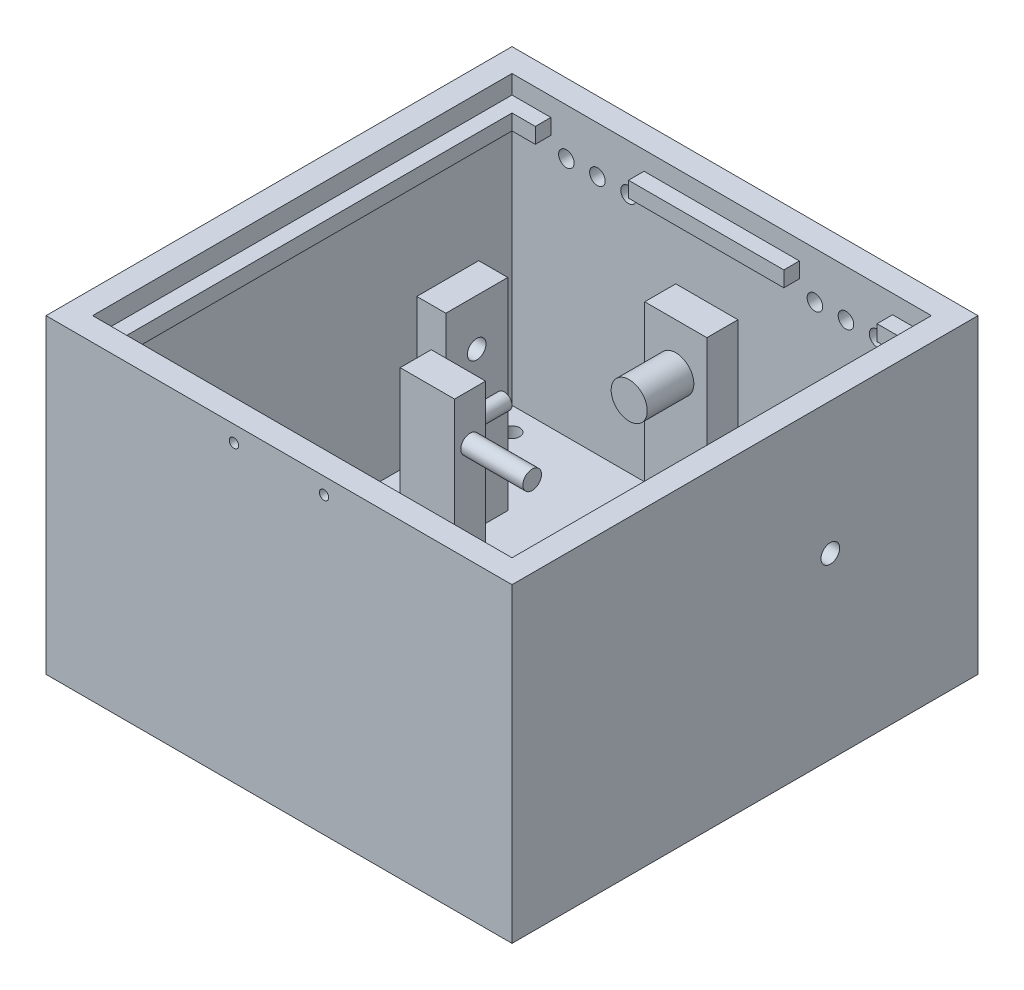
from build123d import *

# Parameters (mm, degrees)
SKETCH1_W            = 150
SKETCH1_H            = 150
BOSS_EXTRUDE1_DEPTH  = 7.5
SKETCH2_W            = 150
SKETCH2_H            = 150
SKETCH2_W_2          = 135
SKETCH2_H_2          = 135
BOSS_EXTRUDE2_DEPTH  = 92.5
SKETCH3_W            = 20
SKETCH3_H            = 10
BOSS_EXTRUDE3_DEPTH  = 65
SKETCH4_R            = 5.8075
BOSS_EXTRUDE4_DEPTH  = 15
SKETCH5_W            = 9.35632758
SKETCH5_H            = 19.933045712
BOSS_EXTRUDE5_DEPTH  = 65
SKETCH7_W            = 17.5
SKETCH7_H            = 5
BOSS_EXTRUDE7_DEPTH  = 65
SKETCH8_R            = 2.5
BOSS_EXTRUDE8_DEPTH  = 17.5
SKETCH10_W           = 17.5
SKETCH10_H           = 5
BOSS_EXTRUDE10_DEPTH = 65
SKETCH12_R           = 3
BOSS_EXTRUDE11_DEPTH = 20
SKETCH6_R            = 3
CUT_EXTRUDE1_DEPTH   = 10
SKETCH13_W           = 16
SKETCH13_H           = 12
BOSS_EXTRUDE12_DEPTH = 12.5
SKETCH14_W           = 35
SKETCH14_H           = 41
BOSS_EXTRUDE13_DEPTH = 31
SKETCH15_R           = 3
CUT_EXTRUDE2_DEPTH   = 10
SKETCH16_W           = 150
SKETCH16_H           = 5
BOSS_EXTRUDE14_DEPTH = 5
SKETCH17_W           = 12.5
SKETCH17_H           = 5
SKETCH17_W_2         = 50
BOSS_EXTRUDE15_DEPTH = 5
SKETCH18_W           = 150
SKETCH18_H           = 5
BOSS_EXTRUDE16_DEPTH = 5
SKETCH19_W           = 150
SKETCH19_H           = 5
BOSS_EXTRUDE17_DEPTH = 5
SKETCH20_R           = 2.5
CUT_EXTRUDE3_DEPTH   = 10
SKETCH21_R           = 2.5
CUT_EXTRUDE4_DEPTH   = 10
SKETCH22_R           = 1.5
CUT_EXTRUDE5_DEPTH   = 5
SKETCH23_R           = 1
SKETCH23_R_2         = 0.6
CUT_EXTRUDE6_DEPTH   = 4
SKETCH24_R           = 0.75
SKETCH24_R_2         = 0.5
CUT_EXTRUDE7_DEPTH   = 4


with BuildPart() as part:
    # Sketch1 → Boss-Extrude1 (new body)
    with BuildSketch(Plane(origin=(0, 0, 0), x_dir=(1, 0, 0), z_dir=(0, 1, 0))):
        Rectangle(SKETCH1_W, SKETCH1_H)
    extrude(amount=BOSS_EXTRUDE1_DEPTH)

    # Sketch2 → Boss-Extrude2 (add)
    with BuildSketch(Plane(origin=(0, 7.5, 0), x_dir=(1, 0, 0), z_dir=(0, 1, 0))):
        Rectangle(SKETCH2_W, SKETCH2_H)
        Rectangle(SKETCH2_W_2, SKETCH2_H_2, mode=Mode.SUBTRACT)
    extrude(amount=BOSS_EXTRUDE2_DEPTH)

    # Sketch3 → Boss-Extrude3 (add)
    with BuildSketch(Plane(origin=(0, 7.5, 0), x_dir=(1, 0, 0), z_dir=(0, 1, 0))):
        with Locations((0, 57.724473197)):
            Rectangle(SKETCH3_W, SKETCH3_H)
    extrude(amount=BOSS_EXTRUDE3_DEPTH)

    # Sketch4 → Boss-Extrude4 (add)
    with BuildSketch(Plane.XY.offset(-52.724473197)):
        with Locations((0, 57.5)):
            Circle(SKETCH4_R)
    extrude(amount=BOSS_EXTRUDE4_DEPTH)

    # Sketch5 → Boss-Extrude5 (add)
    with BuildSketch(Plane(origin=(0, 7.5, 0), x_dir=(1, 0, 0), z_dir=(0, 1, 0))):
        with Locations((-43.5, 27.5)):
            Rectangle(SKETCH5_W, SKETCH5_H)
    extrude(amount=BOSS_EXTRUDE5_DEPTH)

    # Sketch7 → Boss-Extrude7 (add)
    with BuildSketch(Plane(origin=(0, 7.5, 0), x_dir=(1, 0, 0), z_dir=(0, 1, 0))):
        with Locations((-22.25, -2.5)):
            Rectangle(SKETCH7_W, SKETCH7_H)
    extrude(amount=BOSS_EXTRUDE7_DEPTH)

    # Sketch8 → Boss-Extrude8 (add)
    with BuildSketch(Plane(origin=(0, 0, 0), x_dir=(-1, 0, 0), z_dir=(0, 0, -1))):
        with Locations((20, 57.5)):
            Circle(SKETCH8_R)
    extrude(amount=BOSS_EXTRUDE8_DEPTH)

    # Sketch10 → Boss-Extrude10 (add)
    with BuildSketch(Plane(origin=(0, 7.5, 0), x_dir=(1, 0, 0), z_dir=(0, 1, 0))):
        with Locations((-22.25, 2.5)):
            Rectangle(SKETCH10_W, SKETCH10_H)
    extrude(amount=BOSS_EXTRUDE10_DEPTH)

    # Sketch12 → Boss-Extrude11 (add)
    with BuildSketch(Plane(origin=(-13.5, 0, 0), x_dir=(0, 0, -1), z_dir=(1, 0, 0))):
        with Locations((0, 57.5)):
            Circle(SKETCH12_R)
    extrude(amount=BOSS_EXTRUDE11_DEPTH)

    # Sketch6 → Cut-Extrude1 (cut)
    with BuildSketch(Plane(origin=(-38.82183621, 0, 0), x_dir=(0, 0, -1), z_dir=(1, 0, 0))):
        with Locations((27.466522856, 57.5)):
            Circle(SKETCH6_R)
    extrude(amount=-CUT_EXTRUDE1_DEPTH, mode=Mode.SUBTRACT)

    # Sketch13 → Boss-Extrude12 (add)
    with BuildSketch(Plane(origin=(0, 7.5, 0), x_dir=(1, 0, 0), z_dir=(0, 1, 0))):
        with Locations((26.2, 27.5)):
            Rectangle(SKETCH13_W, SKETCH13_H)
    extrude(amount=BOSS_EXTRUDE12_DEPTH)

    # Sketch14 → Boss-Extrude13 (add)
    with BuildSketch(Plane(origin=(0, 7.5, 0), x_dir=(1, 0, 0), z_dir=(0, 1, 0))):
        with Locations((47.5, 13)):
            Rectangle(SKETCH14_W, SKETCH14_H)
    extrude(amount=BOSS_EXTRUDE13_DEPTH)

    # Sketch15 → Cut-Extrude2 (cut)
    with BuildSketch(Plane(origin=(75, 0, 0), x_dir=(0, 0, -1), z_dir=(1, 0, 0))):
        with Locations((27.466523, 57.5)):
            Circle(SKETCH15_R)
    extrude(amount=-CUT_EXTRUDE2_DEPTH, mode=Mode.SUBTRACT)

    # Sketch16 → Boss-Extrude14 (add)
    with BuildSketch(Plane(origin=(0, 0, 67.5), x_dir=(-1, 0, 0), z_dir=(0, 0, -1))):
        with Locations((0, 91.5)):
            Rectangle(SKETCH16_W, SKETCH16_H)
    extrude(amount=BOSS_EXTRUDE14_DEPTH)

    # Sketch17 → Boss-Extrude15 (add)
    with BuildSketch(Plane.XY.offset(-67.5)):
        with Locations((-61.25, 91.5)):
            Rectangle(SKETCH17_W, SKETCH17_H)
        with Locations((0, 91.5)):
            Rectangle(SKETCH17_W_2, SKETCH17_H)
        with Locations((61.25, 91.5)):
            Rectangle(SKETCH17_W, SKETCH17_H)
    extrude(amount=BOSS_EXTRUDE15_DEPTH)

    # Sketch18 → Boss-Extrude16 (add)
    with BuildSketch(Plane.ZY.offset(-67.5)):
        with Locations((0, 91.5)):
            Rectangle(SKETCH18_W, SKETCH18_H)
    extrude(amount=BOSS_EXTRUDE16_DEPTH)

    # Sketch19 → Boss-Extrude17 (add)
    with BuildSketch(Plane(origin=(-67.5, 0, 0), x_dir=(0, 0, -1), z_dir=(1, 0, 0))):
        with Locations((0, 91.5)):
            Rectangle(SKETCH19_W, SKETCH19_H)
    extrude(amount=BOSS_EXTRUDE17_DEPTH)

    # Sketch20 → Cut-Extrude3 (cut)
    with BuildSketch(Plane(origin=(0, 0, -75), x_dir=(-1, 0, 0), z_dir=(0, 0, -1))):
        with Locations((-50, 85)):
            Circle(SKETCH20_R)
        with Locations((-40, 85)):
            Circle(SKETCH20_R)
        with Locations((-30, 85)):
            Circle(SKETCH20_R)
        with Locations((30, 85)):
            Circle(SKETCH20_R)
        with Locations((40, 85)):
            Circle(SKETCH20_R)
        with Locations((50, 85)):
            Circle(SKETCH20_R)
    extrude(amount=-CUT_EXTRUDE3_DEPTH, mode=Mode.SUBTRACT)

    # Sketch21 → Cut-Extrude4 (cut)
    with BuildSketch(Plane.XZ):
        with Locations((-60, 60)):
            Circle(SKETCH21_R)
        with Locations((60, 60)):
            Circle(SKETCH21_R)
        with Locations((-60, -60)):
            Circle(SKETCH21_R)
        with Locations((60, -60)):
            Circle(SKETCH21_R)
    extrude(amount=-CUT_EXTRUDE4_DEPTH, mode=Mode.SUBTRACT)

    # Sketch22 → Cut-Extrude5 (cut)
    with BuildSketch(Plane.XY.offset(75)):
        with Locations((-14.5, 94.75)):
            Circle(SKETCH22_R)
        with Locations((14.5, 94.75)):
            Circle(SKETCH22_R)
    extrude(amount=-CUT_EXTRUDE5_DEPTH, mode=Mode.SUBTRACT)

    # Sketch23 → Cut-Extrude6 (cut)
    with BuildSketch(Plane(origin=(0, 38.5, 0), x_dir=(1, 0, 0), z_dir=(0, 1, 0))):
        with Locations((32.5, 8.61)):
            Circle(SKETCH23_R)
        with Locations((32.5, 27.61)):
            Circle(SKETCH23_R)
        with Locations((63, 31.61)):
            Circle(SKETCH23_R_2)
        with Locations((57, 31.61)):
            Circle(SKETCH23_R_2)
        with Locations((57, 7.31)):
            Circle(SKETCH23_R_2)
        with Locations((63, 7.31)):
            Circle(SKETCH23_R_2)
        with Locations((57, 28.908369489)):
            Circle(SKETCH23_R_2)
        with Locations((63, 28.91)):
            Circle(SKETCH23_R_2)
        with Locations((63, 4.61)):
            Circle(SKETCH23_R_2)
        with Locations((57, 4.61)):
            Circle(SKETCH23_R_2)
    extrude(amount=-CUT_EXTRUDE6_DEPTH, mode=Mode.SUBTRACT)

    # Sketch24 → Cut-Extrude7 (cut)
    with BuildSketch(Plane(origin=(0, 20, 0), x_dir=(1, 0, 0), z_dir=(0, 1, 0))):
        with Locations((23.7, 24.466522856)):
            Circle(SKETCH24_R)
        with Locations((23.7, 30.5)):
            Circle(SKETCH24_R)
        with Locations((19.7, 31.716522856)):
            Circle(SKETCH24_R_2)
        with Locations((19.7, 23.2)):
            Circle(SKETCH24_R_2)
    extrude(amount=-CUT_EXTRUDE7_DEPTH, mode=Mode.SUBTRACT)


solid = part.part
